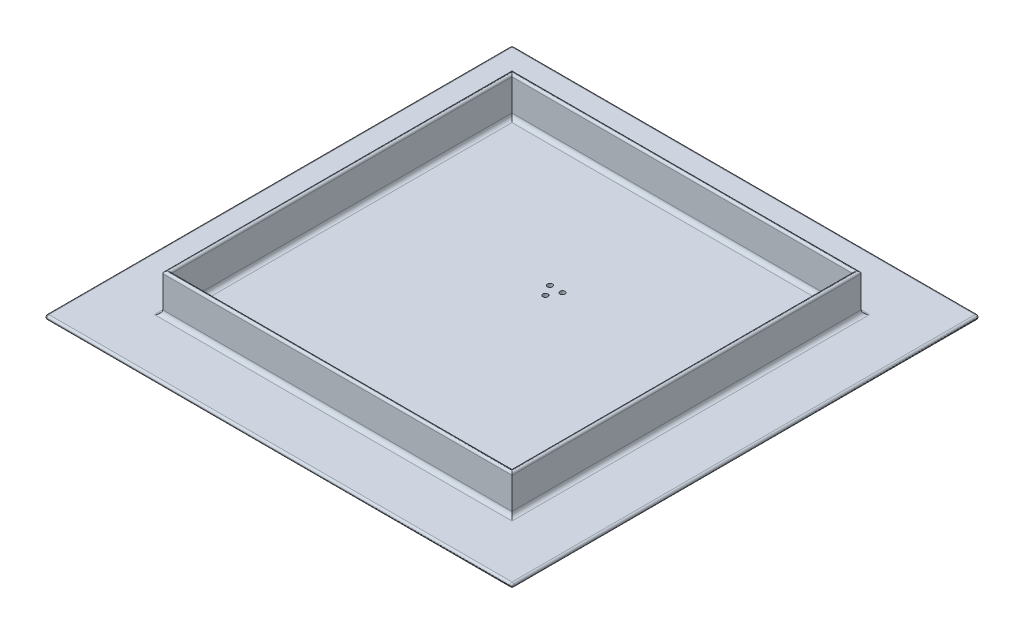
from build123d import *

# Parameters (mm, degrees)
SKETCH1_W           = 560
SKETCH1_H           = 560
BOSS_EXTRUDE1_DEPTH = 5
SKETCH2_W           = 418.578643762
SKETCH2_H           = 418.578643762
SKETCH2_W_2         = 408.578643762
SKETCH2_H_2         = 408.578643762
BOSS_EXTRUDE2_DEPTH = 45
SKETCH3_R           = 3
CUT_EXTRUDE1_DEPTH  = 5
FILLET1_R           = 5
FILLET2_R           = 2.5
FILLET3_R           = 2.5


with BuildPart() as part:
    # Sketch1 → Boss-Extrude1 (new body)
    with BuildSketch(Plane(origin=(0, 0, 0), x_dir=(1, 0, 0), z_dir=(0, 1, 0))):
        Rectangle(SKETCH1_W, SKETCH1_H)
    extrude(amount=BOSS_EXTRUDE1_DEPTH)

    # Sketch2 → Boss-Extrude2 (add)
    with BuildSketch(Plane(origin=(0, 5, 0), x_dir=(1, 0, 0), z_dir=(0, 1, 0))):
        Rectangle(SKETCH2_W, SKETCH2_H)
        Rectangle(SKETCH2_W_2, SKETCH2_H_2, mode=Mode.SUBTRACT)
    extrude(amount=BOSS_EXTRUDE2_DEPTH)

    # Sketch3 → Cut-Extrude1 (cut)
    with BuildSketch(Plane(origin=(0, 5, 0), x_dir=(1, 0, 0), z_dir=(0, 1, 0))):
        with Locations(Location((7.5, 52.990381057, 0), (0, 0, 270))):
            Circle(SKETCH3_R)
        with Locations(Location((0, 40, 0), (0, 0, 270))):
            Circle(SKETCH3_R)
        with Locations(Location((-7.5, 52.990381057, 0), (0, 0, 270))):
            Circle(SKETCH3_R)
    extrude(amount=-CUT_EXTRUDE1_DEPTH, mode=Mode.SUBTRACT)

    # Fillet1
    fillet1_edges = [part.edges().sort_by_distance(p)[0] for p in [
        (0, 5, -204.289321881),
        (204.289321881, 5, 0),
        (-209.289321881, 5, 0),
        (0, 5, 209.289321881),
        (209.289321881, 5, 0),
        (0, 5, -209.289321881),
        (-204.289321881, 5, 0),
        (0, 5, 204.289321881),
    ]]
    fillet(fillet1_edges, radius=FILLET1_R)

    # Fillet2
    fillet2_edges = [part.edges().sort_by_distance(p)[0] for p in [
        (0, 50, 204.289321881),
        (209.289321881, 50, 0),
        (0, 50, -209.289321881),
        (-204.289321881, 50, 0),
        (-209.289321881, 50, 0),
        (0, 50, 209.289321881),
        (0, 50, -204.289321881),
        (204.289321881, 50, 0),
    ]]
    fillet(fillet2_edges, radius=FILLET2_R - 0.0001)  # a hair under: the kernel refuses the full size

    # Fillet3
    fillet3_edges = [part.edges().sort_by_distance(p)[0] for p in [
        (-280, 5, 0),
        (0, 5, 280),
        (280, 5, 0),
        (0, 0, 280),
        (-280, 0, 0),
        (0, 0, -280),
        (280, 0, 0),
        (280, 2.5, 280),
        (-280, 2.5, 280),
        (-280, 2.5, -280),
        (280, 2.5, -280),
        (0, 5, -280),
    ]]
    fillet(fillet3_edges, radius=FILLET3_R - 0.0001)  # a hair under: the kernel refuses the full size


solid = part.part
